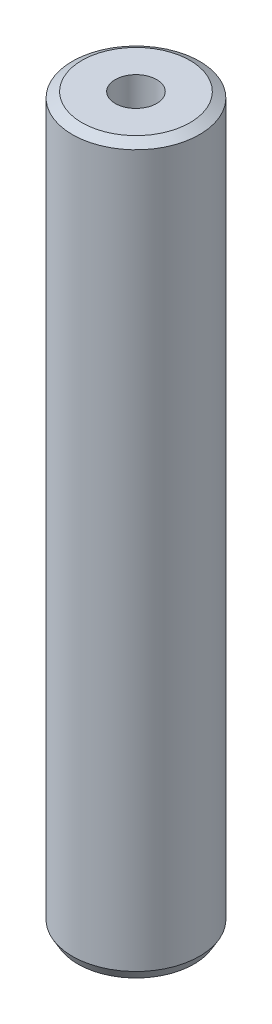
from build123d import *
from OCP.BRepFilletAPI import BRepFilletAPI_MakeChamfer

# Parameters (mm, degrees)
SKETCH1_R           = 52.5
BOSS_EXTRUDE1_DEPTH = 600
SKETCH2_R           = 17.115653141
CUT_EXTRUDE1_DEPTH  = 605.576297914
CHAMFER1_SIZE       = 4.55758662
CHAMFER1_SIZE2      = 7.893971586


with BuildPart() as part:
    # Sketch1 → Boss-Extrude1 (new body)
    with BuildSketch(Plane(origin=(0, 0, 0), x_dir=(1, 0, 0), z_dir=(0, 1, 0))):
        Circle(SKETCH1_R)
    extrude(amount=BOSS_EXTRUDE1_DEPTH)

    # Sketch2 → Cut-Extrude1 (cut, through all)
    with BuildSketch(Plane(origin=(0, 0, 0), x_dir=(1, 0, 0), z_dir=(0, 1, 0))):
        Circle(SKETCH2_R)
    extrude(amount=CUT_EXTRUDE1_DEPTH, mode=Mode.SUBTRACT)

    # Chamfer1: one chamfer whose edges measure the first distance from different faces: ONE call of the kernel's chamfer builder (chamfer() names one face for all edges)
    chamfer1_edges_1 = [part.edges().sort_by_distance(p)[0] for p in [
        (-52.5, 600, 0),
    ]]
    chamfer1_side_1 = [part.faces().sort_by_distance(p)[0] for p in [
        (-52.5, 300, 0),
    ]]
    chamfer1_edges_2 = [part.edges().sort_by_distance(p)[0] for p in [
        (-52.5, 0, 0),
    ]]
    chamfer1_side_2 = [part.faces().sort_by_distance(p)[0] for p in [
        (-51.01507576, 0, 0),
    ]]
    chamfer1 = BRepFilletAPI_MakeChamfer(part.part.solid().wrapped)
    for e in chamfer1_edges_1:
        chamfer1.Add(CHAMFER1_SIZE, CHAMFER1_SIZE2, e.wrapped, chamfer1_side_1[0].wrapped)  # the first distance lies on this face
    for e in chamfer1_edges_2:
        chamfer1.Add(CHAMFER1_SIZE, CHAMFER1_SIZE2, e.wrapped, chamfer1_side_2[0].wrapped)  # the first distance lies on this face
    add(Compound.cast(chamfer1.Shape()), mode=Mode.REPLACE)


solid = part.part
